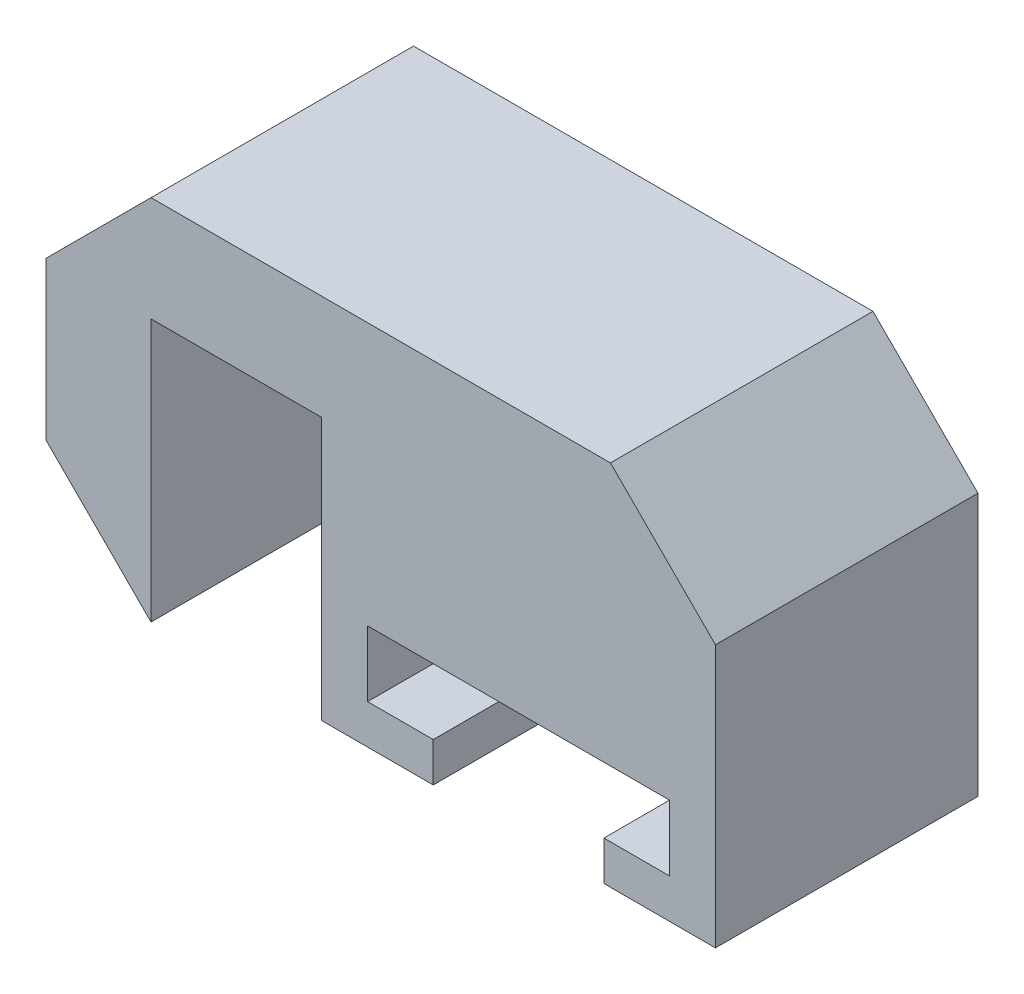
from build123d import *

# Parameters (mm, degrees)
BOSS_EXTRUDE1_DEPTH = 10
CHAMFER1_SIZE       = 4
CUT_EXTRUDE1_DEPTH  = 23.825424421


with BuildPart() as part:
    # Sketch1 → Boss-Extrude1 (new body)
    with BuildSketch(Plane.XY):
        Polygon((0, 0), (15, 0), (15, 14), (-10.5, 14), (-10.5, 0), (-6.5, 0), (-6.5, 10), (0, 10), align=None)
    extrude(amount=BOSS_EXTRUDE1_DEPTH)

    # Chamfer1
    chamfer1_edges = [part.edges().sort_by_distance(p)[0] for p in [
        (-10.5, 14, 5),
        (15, 14, 5),
        (-10.5, 0, 5),
    ]]
    chamfer(chamfer1_edges, length=CHAMFER1_SIZE - 0.0001)  # a hair under: the kernel refuses the full size

    # Sketch2 → Cut-Extrude1 (cut, through all)
    with BuildSketch(Plane.XY.offset(10)):
        Polygon((4.25, 0), (4.25, 1.5), (1.75, 1.5), (1.75, 4), (13.25, 4), (13.25, 1.5), (10.75, 1.5), (10.75, 0), align=None)
    extrude(amount=-CUT_EXTRUDE1_DEPTH, mode=Mode.SUBTRACT)


solid = part.part
